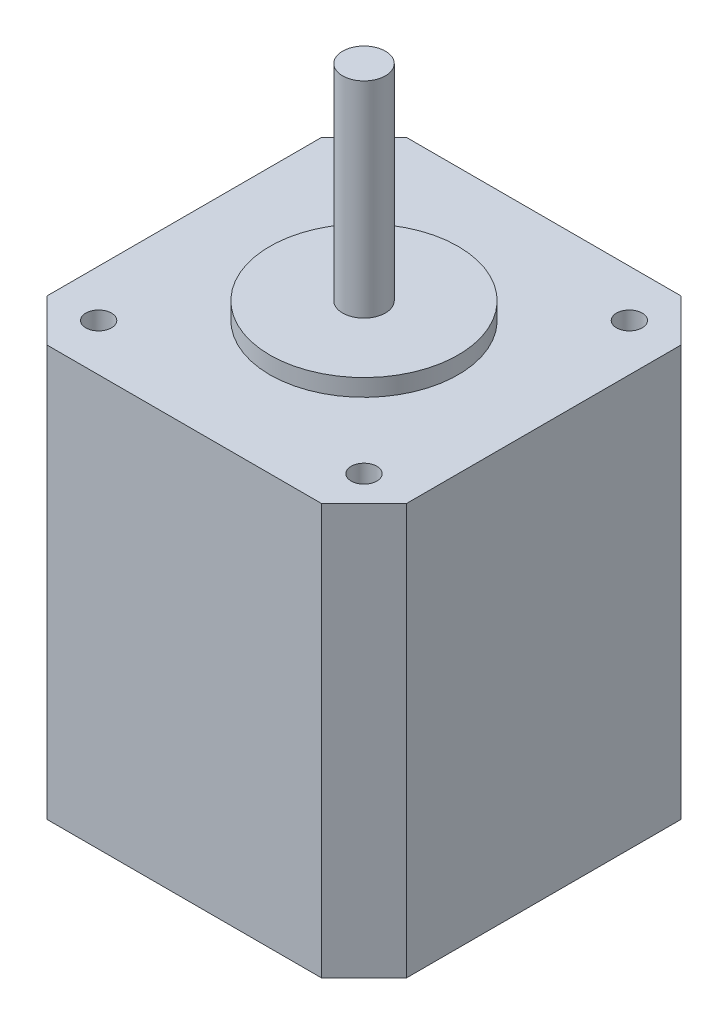
from build123d import *

# Parameters (mm, degrees)
SKETCH1_W           = 42
SKETCH1_H           = 42
BOSS_EXTRUDE1_DEPTH = 48
SKETCH5_R           = 11
BOSS_EXTRUDE4_DEPTH = 2
SKETCH6_R           = 2.5
BOSS_EXTRUDE5_DEPTH = 24
SKETCH8_R           = 1.5
CUT_EXTRUDE1_DEPTH  = 4.5
CUT_EXTRUDE2_DEPTH  = 77.367532368


with BuildPart() as part:
    # Sketch1 → Boss-Extrude1 (new body)
    with BuildSketch(Plane(origin=(0, 0, 0), x_dir=(1, 0, 0), z_dir=(0, 1, 0))):
        with Locations((21, 21)):
            Rectangle(SKETCH1_W, SKETCH1_H)
    extrude(amount=BOSS_EXTRUDE1_DEPTH)

    # Sketch5 → Boss-Extrude4 (add)
    with BuildSketch(Plane(origin=(0, 48, 0), x_dir=(1, 0, 0), z_dir=(0, 1, 0))):
        with Locations((21, 21)):
            Circle(SKETCH5_R)
    extrude(amount=BOSS_EXTRUDE4_DEPTH)

    # Sketch6 → Boss-Extrude5 (add)
    with BuildSketch(Plane(origin=(0, 50, 0), x_dir=(1, 0, 0), z_dir=(0, 1, 0))):
        with Locations((21, 21)):
            Circle(SKETCH6_R)
    extrude(amount=BOSS_EXTRUDE5_DEPTH)

    # Sketch8 → Cut-Extrude1 (cut)
    with BuildSketch(Plane(origin=(0, 48, 0), x_dir=(1, 0, 0), z_dir=(0, 1, 0))):
        with Locations((36.5, 5.5)):
            Circle(SKETCH8_R)
        with Locations((36.5, 36.5)):
            Circle(SKETCH8_R)
        with Locations((5.5, 5.5)):
            Circle(SKETCH8_R)
        with Locations((5.5, 36.5)):
            Circle(SKETCH8_R)
    extrude(amount=-CUT_EXTRUDE1_DEPTH, mode=Mode.SUBTRACT)

    # Sketch9 → Cut-Extrude2 (cut, through all)
    with BuildSketch(Plane(origin=(0, 48, 0), x_dir=(1, 0, 0), z_dir=(0, 1, 0))):
        Polygon((0, 4.949747468), (4.949747468, 0), (0, 0), align=None)
        Polygon((37.050252532, 0), (42, 4.949747468), (42, 0), align=None)
        Polygon((37.050252532, 42), (42, 37.050252532), (42, 42), align=None)
        Polygon((0, 37.050252532), (4.949747468, 42), (0, 42), align=None)
    extrude(amount=-CUT_EXTRUDE2_DEPTH, mode=Mode.SUBTRACT)


solid = part.part
